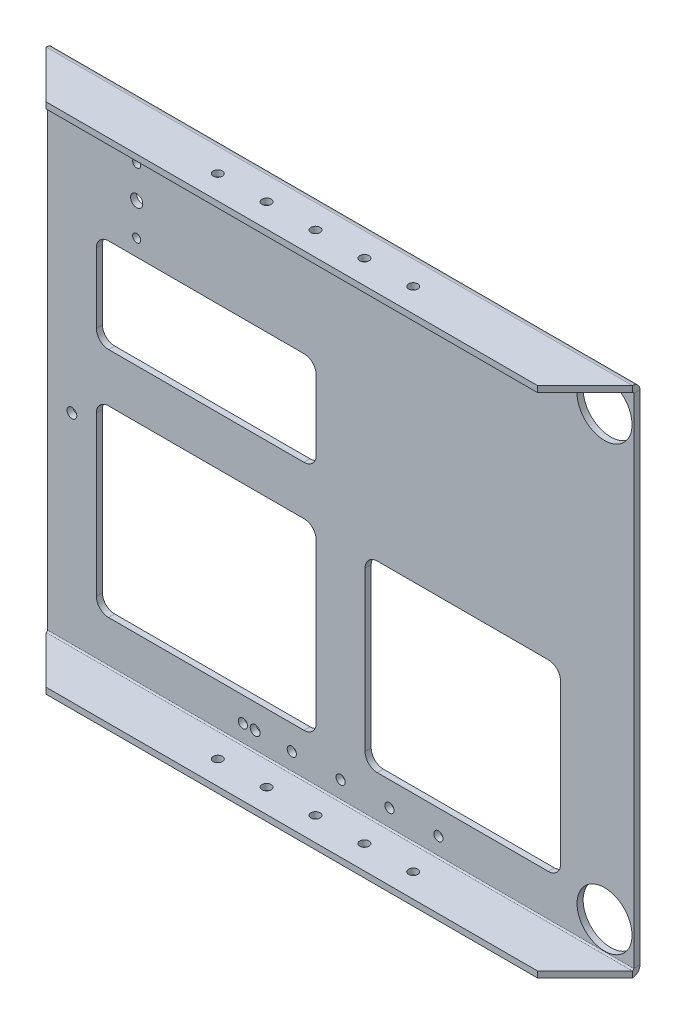
from build123d import *

# Parameters (mm, degrees)
SKETCH1_W                    = 304.8
SKETCH1_H                    = 266.7
SKETCH1_R                    = 14.2875
SKETCH1_R_2                  = 3.175
SKETCH1_R_3                  = 2.0955
SKETCH1_R_4                  = 2.3876
SKETCH1_R_5                  = 2.5527
BASE_FLANGE1_DEPTH           = 3.175
EDGE_FLANGE1_STRIP_W         = 14.1732
EDGE_FLANGE1_STRIP_H         = 3.175
EDGE_FLANGE1_STRIP_CUT_DEPTH = 304.8
EDGE_FLANGE1_DEPTH           = 304.8
EDGE_FLANGE2_STRIP_W         = 14.1732
EDGE_FLANGE2_STRIP_H         = 3.175
EDGE_FLANGE2_STRIP_CUT_DEPTH = 304.8
EDGE_FLANGE2_DEPTH           = 304.8
CUT_EXTRUDE1_DEPTH           = 406.80425084
CUT_EXTRUDE2_DEPTH           = 406.80425084
SKETCH15_R                   = 2.3876
CUT_EXTRUDE3_DEPTH           = 406.80425084


# Sheet-metal steps are written as plain solids
with BuildPart() as part:
    # Sketch1 → Base-Flange1 (new body)
    with BuildSketch(Plane.XY):
        with Locations((152.4, 133.35)):
            Rectangle(SKETCH1_W, SKETCH1_H)
        with Locations((289.56, 18.415)):
            Circle(SKETCH1_R, mode=Mode.SUBTRACT)
        with Locations(Location((289.56, 248.285, 0), (0, 0, 180))):
            Circle(SKETCH1_R, mode=Mode.SUBTRACT)
        with Locations((46.355, 220.345)):
            Circle(SKETCH1_R_2, mode=Mode.SUBTRACT)
        with Locations((46.355, 237.187832598)):
            Circle(SKETCH1_R_3, mode=Mode.SUBTRACT)
        with Locations((46.355, 203.502167402)):
            Circle(SKETCH1_R_3, mode=Mode.SUBTRACT)
        with Locations((152.4, 12.7)):
            Circle(SKETCH1_R_4, mode=Mode.SUBTRACT)
        with Locations((177.8, 12.7)):
            Circle(SKETCH1_R_4, mode=Mode.SUBTRACT)
        with Locations((203.2, 12.7)):
            Circle(SKETCH1_R_4, mode=Mode.SUBTRACT)
        with Locations((127, 12.7)):
            Circle(SKETCH1_R_4, mode=Mode.SUBTRACT)
        with Locations((101.6, 12.7)):
            Circle(SKETCH1_R_4, mode=Mode.SUBTRACT)
        with Locations(Location((101.6, 254, 0), (0, 0, 180))):
            Circle(SKETCH1_R_4, mode=Mode.SUBTRACT)
        with Locations(Location((127, 254, 0), (0, 0, 180))):
            Circle(SKETCH1_R_4, mode=Mode.SUBTRACT)
        with Locations(Location((203.2, 254, 0), (0, 0, 180))):
            Circle(SKETCH1_R_4, mode=Mode.SUBTRACT)
        with Locations(Location((177.8, 254, 0), (0, 0, 180))):
            Circle(SKETCH1_R_4, mode=Mode.SUBTRACT)
        with Locations(Location((152.4, 254, 0), (0, 0, 180))):
            Circle(SKETCH1_R_4, mode=Mode.SUBTRACT)
        with Locations((107.95, 12.7)):
            Circle(SKETCH1_R_5, mode=Mode.SUBTRACT)
        with Locations((12.7, 107.95)):
            Circle(SKETCH1_R_5, mode=Mode.SUBTRACT)
        with BuildLine():
            Line((171.45, 120.65), (260.35, 120.65))
            ThreePointArc((260.35, 120.65), (264.840128061, 118.790128061), (266.7, 114.3))
            Line((266.7, 114.3), (266.7, 31.75))
            ThreePointArc((266.7, 31.75), (264.840128061, 27.259871939), (260.35, 25.4))
            Line((260.35, 25.4), (171.45, 25.4))
            ThreePointArc((171.45, 25.4), (166.959871939, 27.259871939), (165.1, 31.75))
            Line((165.1, 31.75), (165.1, 114.3))
            ThreePointArc((165.1, 114.3), (166.959871939, 118.790128061), (171.45, 120.65))
        make_face(mode=Mode.SUBTRACT)
        with BuildLine():
            Line((31.75, 120.65), (133.35, 120.65))
            ThreePointArc((133.35, 120.65), (137.840128061, 118.790128061), (139.7, 114.3))
            Line((139.7, 114.3), (139.7, 31.75))
            ThreePointArc((139.7, 31.75), (137.840128061, 27.259871939), (133.35, 25.4))
            Line((133.35, 25.4), (31.75, 25.4))
            ThreePointArc((31.75, 25.4), (27.259871939, 27.259871939), (25.4, 31.75))
            Line((25.4, 31.75), (25.4, 114.3))
            ThreePointArc((25.4, 114.3), (27.259871939, 118.790128061), (31.75, 120.65))
        make_face(mode=Mode.SUBTRACT)
        with BuildLine():
            Line((31.75, 194.945), (133.35, 194.945))
            ThreePointArc((133.35, 194.945), (137.840128061, 193.085128061), (139.7, 188.595))
            Line((139.7, 188.595), (139.7, 152.4))
            ThreePointArc((139.7, 152.4), (137.840128061, 147.909871939), (133.35, 146.05))
            Line((133.35, 146.05), (31.75, 146.05))
            ThreePointArc((31.75, 146.05), (27.259871939, 147.909871939), (25.4, 152.4))
            Line((25.4, 152.4), (25.4, 188.595))
            ThreePointArc((25.4, 188.595), (27.259871939, 193.085128061), (31.75, 194.945))
        make_face(mode=Mode.SUBTRACT)
    extrude(amount=-BASE_FLANGE1_DEPTH)

    # Edge-Flange1 strip (across the edge) → Edge-Flange1 strip cut (cut)
    with BuildSketch(Plane(origin=(304.8, 266.7, 0), x_dir=(0, -1, 0), z_dir=(-1, 0, 0))):
        with Locations((-3.175, -1.5875)):
            Rectangle(EDGE_FLANGE1_STRIP_W, EDGE_FLANGE1_STRIP_H)
    extrude(amount=EDGE_FLANGE1_STRIP_CUT_DEPTH, mode=Mode.SUBTRACT)

    # Edge-Flange1 section (across the edge) → Edge-Flange1 (add)
    with BuildSketch(Plane(origin=(304.8, 266.7, 0), x_dir=(0, -1, 0), z_dir=(-1, 0, 0))):
        with BuildLine():
            Line((0, 0.7366), (0, 25.4))
            Line((0, 25.4), (3.175, 25.4))
            Line((3.175, 25.4), (3.175, 0.7366))
            ThreePointArc((3.175, 0.7366), (3.390745145, 0.215745145), (3.9116, 0))
            Line((3.9116, 0), (3.9116, -3.175))
            ThreePointArc((3.9116, -3.175), (1.145681115, -2.029318885), (0, 0.7366))
        make_face()
    extrude(amount=EDGE_FLANGE1_DEPTH)

    # Edge-Flange2 strip (across the edge) → Edge-Flange2 strip cut (cut)
    with BuildSketch(Plane.YZ):
        with Locations((-3.175, -1.5875)):
            Rectangle(EDGE_FLANGE2_STRIP_W, EDGE_FLANGE2_STRIP_H)
    extrude(amount=EDGE_FLANGE2_STRIP_CUT_DEPTH, mode=Mode.SUBTRACT)

    # Edge-Flange2 section (across the edge) → Edge-Flange2 (add)
    with BuildSketch(Plane.YZ):
        with BuildLine():
            Line((0, 0.7366), (0, 25.4))
            Line((0, 25.4), (3.175, 25.4))
            Line((3.175, 25.4), (3.175, 0.7366))
            ThreePointArc((3.175, 0.7366), (3.390745145, 0.215745145), (3.9116, 0))
            Line((3.9116, 0), (3.9116, -3.175))
            ThreePointArc((3.9116, -3.175), (1.145681115, -2.029318885), (0, 0.7366))
        make_face()
    extrude(amount=EDGE_FLANGE2_DEPTH)

    # Sketch12 → Cut-Extrude1 (cut, through all)
    with BuildSketch(Plane(origin=(0, 0, 0), x_dir=(-1, 0, 0), z_dir=(0, -1, 0))):
        Polygon((-304.8, -0.7366), (-280.1366, -25.4), (-304.8, -25.4), align=None)
    extrude(amount=-CUT_EXTRUDE1_DEPTH, mode=Mode.SUBTRACT)

    # Sketch14 → Cut-Extrude2 (cut, through all)
    with BuildSketch(Plane.XZ):
        Polygon((0, 0.7366), (24.6634, 25.4), (0, 25.4), align=None)
    extrude(amount=-CUT_EXTRUDE2_DEPTH, mode=Mode.SUBTRACT)

    # Sketch15 → Cut-Extrude3 (cut, through all)
    with BuildSketch(Plane.XZ):
        with Locations(Location((152.4, 13.0683, 0), (0, 0, 270))):
            Circle(SKETCH15_R)
        with Locations(Location((177.8, 13.0683, 0), (0, 0, 270))):
            Circle(SKETCH15_R)
        with Locations(Location((203.2, 13.0683, 0), (0, 0, 270))):
            Circle(SKETCH15_R)
        with Locations(Location((127, 13.0683, 0), (0, 0, 270))):
            Circle(SKETCH15_R)
        with Locations(Location((101.6, 13.0683, 0), (0, 0, 270))):
            Circle(SKETCH15_R)
    extrude(amount=-CUT_EXTRUDE3_DEPTH, mode=Mode.SUBTRACT)


solid = part.part
